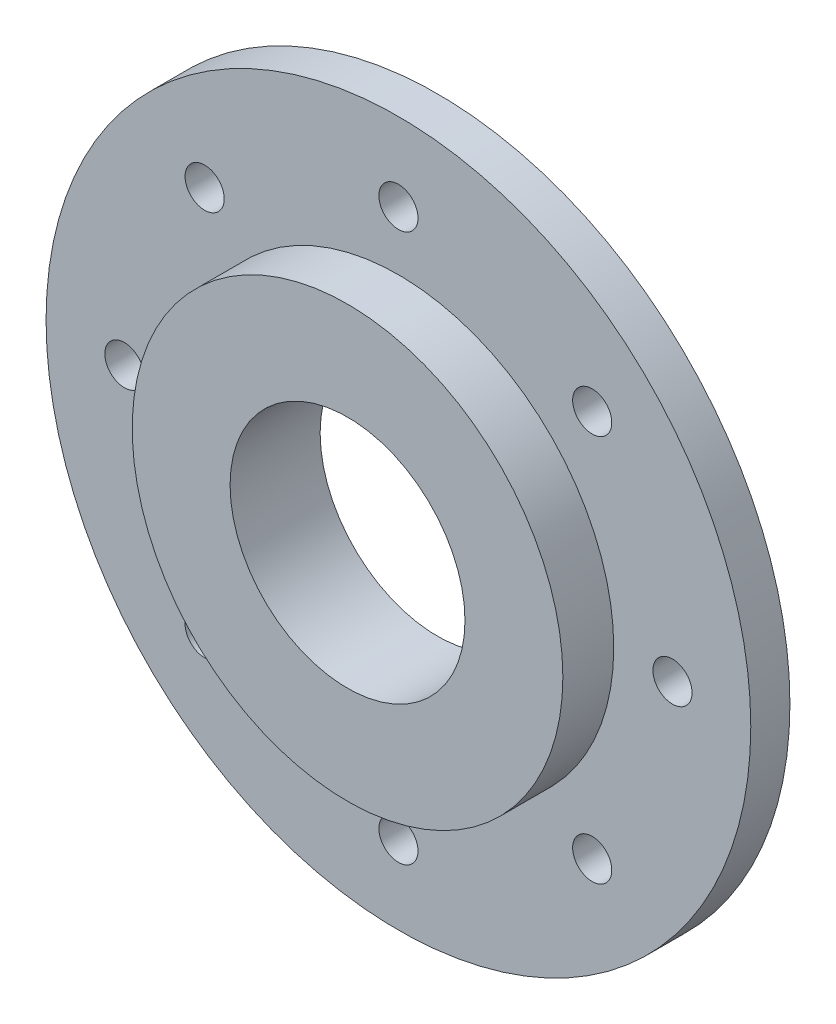
from build123d import *

# Parameters (mm, degrees)
SKETCH1_R                    = 17.4625
BOSS_EXTRUDE1_DEPTH          = 4.1275
SKETCH2_R                    = 28.575
BOSS_EXTRUDE2_DEPTH          = 3.175
F_1_8_0_125_DIAMETER_HOLE1_D = 3.175
CIRPATTERN1_COUNT            = 8
CUT_EXTRUDE1_REACH           = 43.066
SKETCH5_R                    = 9.525


with BuildPart() as part:
    # Sketch1 → Boss-Extrude1 (new body)
    with BuildSketch(Plane.XY):
        Circle(SKETCH1_R)
    extrude(amount=BOSS_EXTRUDE1_DEPTH)

    # Sketch2 → Boss-Extrude2 (add)
    with BuildSketch(Plane(origin=(0, 0, 0), x_dir=(-1, 0, 0), z_dir=(0, 0, -1))):
        Circle(SKETCH2_R)
    extrude(amount=BOSS_EXTRUDE2_DEPTH)

    # 1/8 (0.125) Diameter Hole1 (through all)
    with Locations(Plane(origin=(0, 0, -3.175), x_dir=(-1, 0, 0), z_dir=(0, 0, -1))):
        with Locations((0, 22.225)):
            f_1_8_0_125_diameter_hole1 = Hole(F_1_8_0_125_DIAMETER_HOLE1_D / 2)

    # CirPattern1: 1/8 (0.125) Diameter Hole1 ×8 about axis
    cirpattern1_axis = Axis((0, 0, -3.175), (0, 0, -1))
    for i in range(1, CIRPATTERN1_COUNT):
        add(f_1_8_0_125_diameter_hole1.rotate(cirpattern1_axis, i * 360 / CIRPATTERN1_COUNT), mode=Mode.SUBTRACT)

    # Sketch5 → Cut-Extrude1 (cut, up to next)
    with BuildSketch(Plane(origin=(0, 0, -3.175), x_dir=(-1, 0, 0), z_dir=(0, 0, -1)), mode=Mode.PRIVATE) as cut_extrude1_sk1:
        Circle(SKETCH5_R)
    cut_extrude1_tool1 = extrude(cut_extrude1_sk1.sketch, amount=-CUT_EXTRUDE1_REACH, mode=Mode.PRIVATE) & part.part
    add(cut_extrude1_tool1.solids().sort_by_distance((0, 0, -3.175))[0], mode=Mode.SUBTRACT)


solid = part.part
